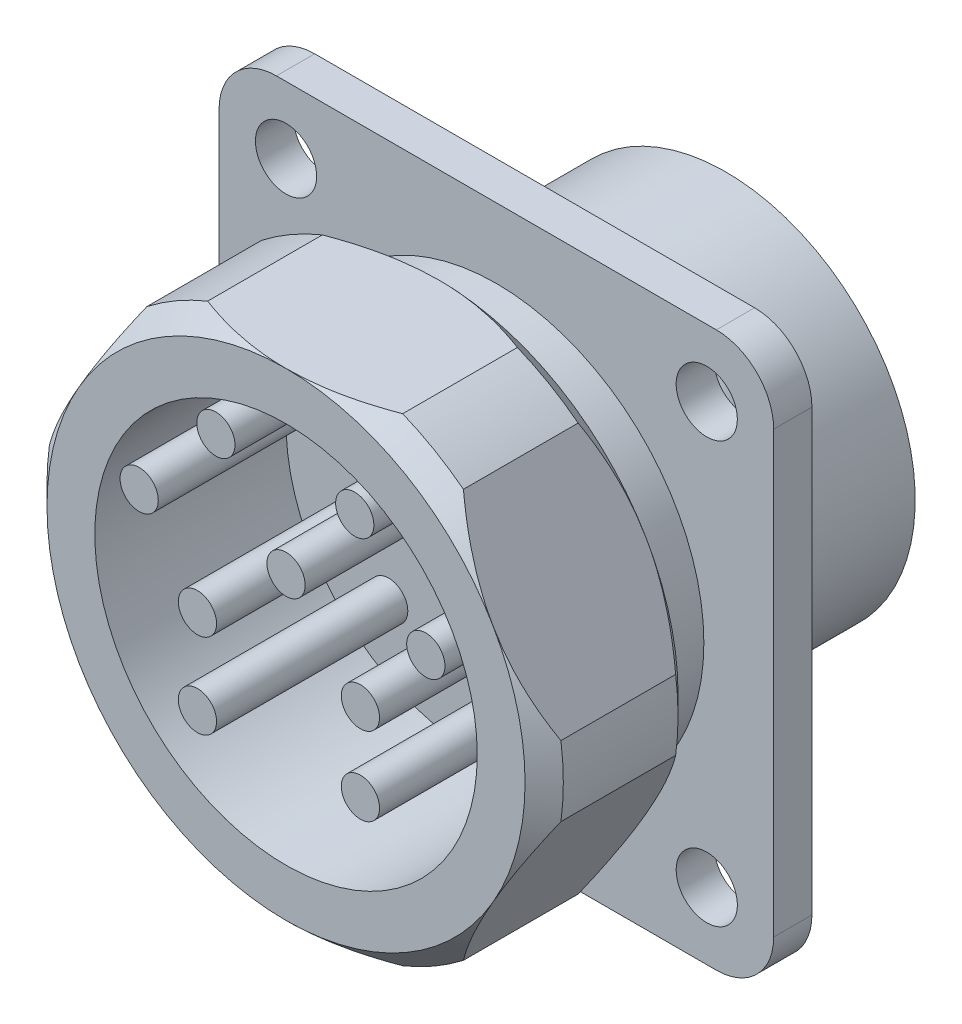
from build123d import *

# Parameters (mm, degrees)
SKETCH_1_R          = 1.6
EXTRUDE_1_DEPTH     = 2
SKETCH_2_R          = 10.85
EXTRUDE_2_DEPTH     = 3
EXTRUDE_3_DEPTH     = 8
SKETCH_4_R          = 9.9
EXTRUDE_4_DEPTH     = 10
CHAMFER_1_SIZE      = 1
CHAMFER_2_SIZE      = 1
SKETCH_5_R          = 10
SKETCH_5_R_2        = 1
CUT_EXTRUDE_1_DEPTH = 10


with BuildPart() as part:
    # 草图1 → 凸台-拉伸1 (new body)
    with BuildSketch(Plane.XY):
        with BuildLine():
            Line((-11.5, -14.5), (11.5, -14.5))
            ThreePointArc((11.5, -14.5), (13.621320344, -13.621320344), (14.5, -11.5))
            Line((14.5, -11.5), (14.5, 11.5))
            ThreePointArc((14.5, 11.5), (13.621320344, 13.621320344), (11.5, 14.5))
            Line((11.5, 14.5), (-11.5, 14.5))
            ThreePointArc((-11.5, 14.5), (-13.621320344, 13.621320344), (-14.5, 11.5))
            Line((-14.5, 11.5), (-14.5, -11.5))
            ThreePointArc((-14.5, -11.5), (-13.621320344, -13.621320344), (-11.5, -14.5))
        make_face()
        with Locations((11, 11)):
            Circle(SKETCH_1_R, mode=Mode.SUBTRACT)
        with Locations(Location((-11, 11, 0), (0, 0, 180))):
            Circle(SKETCH_1_R, mode=Mode.SUBTRACT)
        with Locations((-11, -11)):
            Circle(SKETCH_1_R, mode=Mode.SUBTRACT)
        with Locations(Location((11, -11, 0), (0, 0, 180))):
            Circle(SKETCH_1_R, mode=Mode.SUBTRACT)
    extrude(amount=-EXTRUDE_1_DEPTH)

    # 草图2 → 凸台-拉伸2 (add)
    with BuildSketch(Plane.XY):
        with Locations(Location((0, 0, 0), (0, 0, 180))):
            Circle(SKETCH_2_R)
    extrude(amount=EXTRUDE_2_DEPTH)

    # 草图3 → 凸台-拉伸3 (add)
    with BuildSketch(Plane.XY.offset(3)):
        with BuildLine():
            Line((13.374827304, 1.834119567), (8.275807791, 10.665880433))
            ThreePointArc((8.275807791, 10.665880433), (6.75, 11.691342951), (5.099019514, 12.5))
            Line((5.099019514, 12.5), (-5.099019514, 12.5))
            ThreePointArc((-5.099019514, 12.5), (-6.75, 11.691342951), (-8.275807791, 10.665880433))
            Line((-8.275807791, 10.665880433), (-13.374827304, 1.834119567))
            ThreePointArc((-13.374827304, 1.834119567), (-13.5, 0), (-13.374827304, -1.834119567))
            Line((-13.374827304, -1.834119567), (-8.275807791, -10.665880433))
            ThreePointArc((-8.275807791, -10.665880433), (-6.75, -11.691342951), (-5.099019514, -12.5))
            Line((-5.099019514, -12.5), (5.099019514, -12.5))
            ThreePointArc((5.099019514, -12.5), (6.75, -11.691342951), (8.275807791, -10.665880433))
            Line((8.275807791, -10.665880433), (13.374827304, -1.834119567))
            ThreePointArc((13.374827304, -1.834119567), (13.5, 0), (13.374827304, 1.834119567))
        make_face()
    extrude(amount=EXTRUDE_3_DEPTH)

    # 草图4 → 凸台-拉伸4 (add)
    with BuildSketch(Plane(origin=(0, 0, -2), x_dir=(-1, 0, 0), z_dir=(0, 0, -1))):
        Circle(SKETCH_4_R)
    extrude(amount=EXTRUDE_4_DEPTH)

    # 倒角1
    chamfer_1_edges = [part.edges().sort_by_distance(p)[0] for p in [
        (-6.75, -11.691342951, 3),
        (-13.5, 0, 3),
        (-6.75, 11.691342951, 3),
        (6.75, 11.691342951, 3),
        (6.75, -11.691342951, 3),
        (13.5, 0, 3),
    ]]
    chamfer(chamfer_1_edges, length=CHAMFER_1_SIZE - 0.0001)  # a hair under: the kernel refuses the full size

    # 倒角2
    chamfer_2_edges = [part.edges().sort_by_distance(p)[0] for p in [
        (13.5, 0, 11),
        (6.75, 11.691342951, 11),
        (6.75, -11.691342951, 11),
        (-6.75, -11.691342951, 11),
        (-6.75, 11.691342951, 11),
        (-13.5, 0, 11),
    ]]
    chamfer(chamfer_2_edges, length=CHAMFER_2_SIZE - 0.0001)  # a hair under: the kernel refuses the full size

    # 草图5 → 切除-拉伸1 (cut)
    with BuildSketch(Plane.XY.offset(11)):
        Circle(SKETCH_5_R)
        with Locations((-3.66926495, 7.697601599)):
            Circle(SKETCH_5_R_2, mode=Mode.SUBTRACT)
        with Locations((3.593463585, 7.697601599)):
            Circle(SKETCH_5_R_2, mode=Mode.SUBTRACT)
        with Locations((-7.680655711, 3.179508847)):
            Circle(SKETCH_5_R_2, mode=Mode.SUBTRACT)
        with Locations((0, 3.179508847)):
            Circle(SKETCH_5_R_2, mode=Mode.SUBTRACT)
        with Locations((7.309278185, 3.179508847)):
            Circle(SKETCH_5_R_2, mode=Mode.SUBTRACT)
        with Locations((-4.63214688, -0.87410708)):
            Circle(SKETCH_5_R_2, mode=Mode.SUBTRACT)
        with Locations((3.889039747, -0.87410708)):
            Circle(SKETCH_5_R_2, mode=Mode.SUBTRACT)
        with Locations((-4.63214688, -5.3077495)):
            Circle(SKETCH_5_R_2, mode=Mode.SUBTRACT)
        with Locations((3.889039747, -4.969948172)):
            Circle(SKETCH_5_R_2, mode=Mode.SUBTRACT)
    extrude(amount=-CUT_EXTRUDE_1_DEPTH, mode=Mode.SUBTRACT)


solid = part.part
